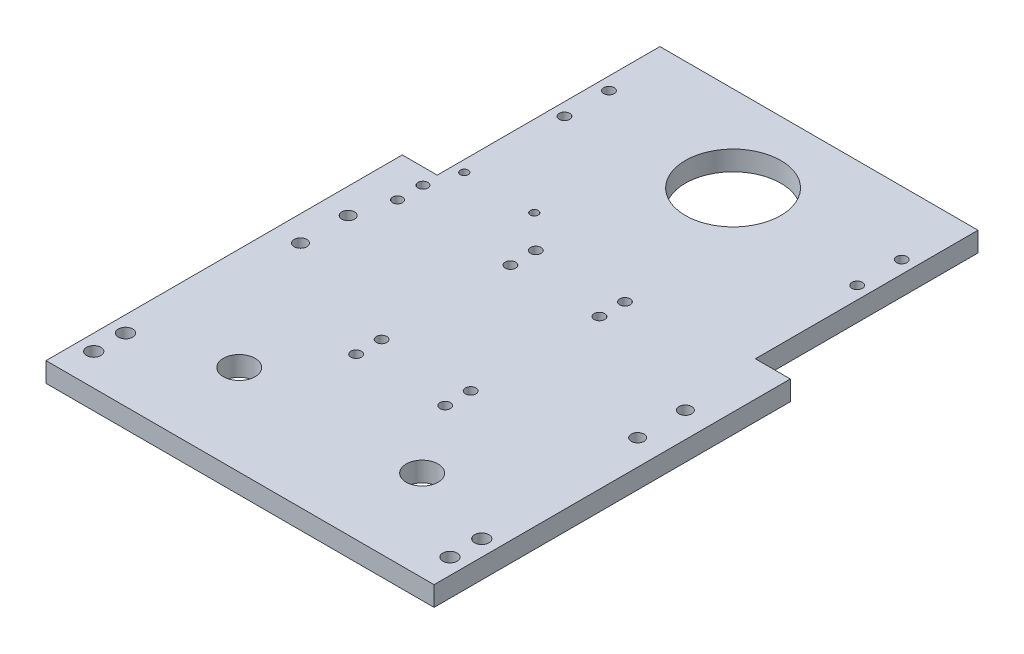
from build123d import *

# Parameters (mm, degrees)
SKETCH1_W           = 122
SKETCH1_H           = 112
BOSS_EXTRUDE1_DEPTH = 6.2
SKETCH2_W           = 100
SKETCH2_H           = 70
BOSS_EXTRUDE2_DEPTH = 6.2
SKETCH3_R           = 1.25
SKETCH3_R_2         = 1.65
SKETCH3_R_3         = 15
CUT_EXTRUDE1_DEPTH  = 141.126514265
SKETCH4_R           = 1.55
SKETCH4_R_2         = 1.65
CUT_EXTRUDE2_DEPTH  = 141.126514265
SKETCH5_R           = 2
CUT_EXTRUDE3_DEPTH  = 10
SKETCH6_R           = 5
CUT_EXTRUDE4_DEPTH  = 10
SKETCH7_R           = 2.25
CUT_EXTRUDE5_DEPTH  = 141.126514265


with BuildPart() as part:
    # Sketch1 → Boss-Extrude1 (new body)
    with BuildSketch(Plane(origin=(0, 0, 0), x_dir=(1, 0, 0), z_dir=(0, 1, 0))):
        Rectangle(SKETCH1_W, SKETCH1_H)
    extrude(amount=BOSS_EXTRUDE1_DEPTH)

    # Sketch2 → Boss-Extrude2 (add)
    with BuildSketch(Plane(origin=(0, 0, 0), x_dir=(1, 0, 0), z_dir=(0, 1, 0))):
        with Locations((0, 91)):
            Rectangle(SKETCH2_W, SKETCH2_H)
    extrude(amount=BOSS_EXTRUDE2_DEPTH)

    # Sketch3 → Cut-Extrude1 (cut, through all)
    with BuildSketch(Plane(origin=(0, 6.2, 0), x_dir=(1, 0, 0), z_dir=(0, 1, 0))):
        with Locations((-46.5, 61)):
            Circle(SKETCH3_R)
        with Locations((-24.5, 61)):
            Circle(SKETCH3_R)
        with Locations((-46.013, 106)):
            Circle(SKETCH3_R_2)
        with Locations((0, 99)):
            Circle(SKETCH3_R_3)
        with Locations((-46.013, 92)):
            Circle(SKETCH3_R_2)
        with Locations((46.013, 92)):
            Circle(SKETCH3_R_2)
        with Locations((46.013, 106)):
            Circle(SKETCH3_R_2)
    extrude(amount=-CUT_EXTRUDE1_DEPTH, mode=Mode.SUBTRACT)

    # Sketch4 → Cut-Extrude2 (cut, through all)
    with BuildSketch(Plane(origin=(0, 6.2, 0), x_dir=(1, 0, 0), z_dir=(0, 1, 0))):
        with Locations((-49.5, 51)):
            Circle(SKETCH4_R)
        with Locations((-49.5, 43)):
            Circle(SKETCH4_R)
        with Locations((-14, 2.5)):
            Circle(SKETCH4_R_2)
        with Locations((14, 2.5)):
            Circle(SKETCH4_R_2)
        with Locations((14, -5.5)):
            Circle(SKETCH4_R_2)
        with Locations((-14, -5.5)):
            Circle(SKETCH4_R_2)
        with Locations((-14, 51)):
            Circle(SKETCH4_R_2)
        with Locations((14, 51)):
            Circle(SKETCH4_R_2)
        with Locations((14, 43)):
            Circle(SKETCH4_R_2)
        with Locations((-14, 43)):
            Circle(SKETCH4_R_2)
    extrude(amount=-CUT_EXTRUDE2_DEPTH, mode=Mode.SUBTRACT)

    # Sketch5 → Cut-Extrude3 (cut)
    with BuildSketch(Plane(origin=(0, 6.2, 0), x_dir=(1, 0, 0), z_dir=(0, 1, 0))):
        with Locations((-53, 31)):
            Circle(SKETCH5_R)
        with Locations((-53, 16)):
            Circle(SKETCH5_R)
        with Locations((53, 16)):
            Circle(SKETCH5_R)
        with Locations((53, 31)):
            Circle(SKETCH5_R)
    extrude(amount=-CUT_EXTRUDE3_DEPTH, mode=Mode.SUBTRACT)

    # Sketch6 → Cut-Extrude4 (cut)
    with BuildSketch(Plane(origin=(0, 6.2, 0), x_dir=(1, 0, 0), z_dir=(0, 1, 0))):
        with Locations((-28.75, -27.5)):
            Circle(SKETCH6_R)
        with Locations((28.75, -27.5)):
            Circle(SKETCH6_R)
    extrude(amount=-CUT_EXTRUDE4_DEPTH, mode=Mode.SUBTRACT)

    # Sketch7 → Cut-Extrude5 (cut, through all)
    with BuildSketch(Plane(origin=(0, 6.2, 0), x_dir=(1, 0, 0), z_dir=(0, 1, 0))):
        with Locations((-56, -36)):
            Circle(SKETCH7_R)
        with Locations((-56, -46)):
            Circle(SKETCH7_R)
        with Locations((56, -46)):
            Circle(SKETCH7_R)
        with Locations((56, -36)):
            Circle(SKETCH7_R)
    extrude(amount=-CUT_EXTRUDE5_DEPTH, mode=Mode.SUBTRACT)


solid = part.part
